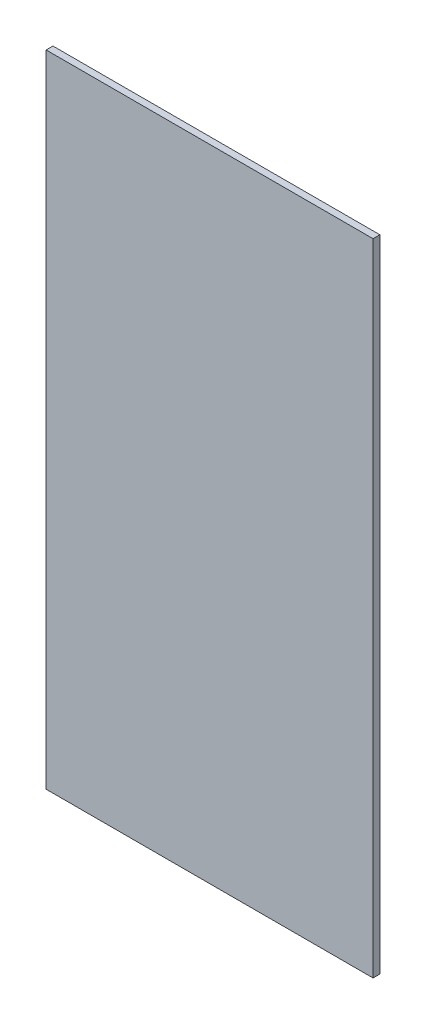
from build123d import *

# Parameters (mm, degrees)
SKETCH1_W           = 304.8
SKETCH1_H           = 596.9
BOSS_EXTRUDE1_DEPTH = 6.35


with BuildPart() as part:
    # Sketch1 → Boss-Extrude1 (new body)
    with BuildSketch(Plane.XY):
        with Locations((-152.4, 298.45)):
            Rectangle(SKETCH1_W, SKETCH1_H)
    extrude(amount=BOSS_EXTRUDE1_DEPTH)


solid = part.part
